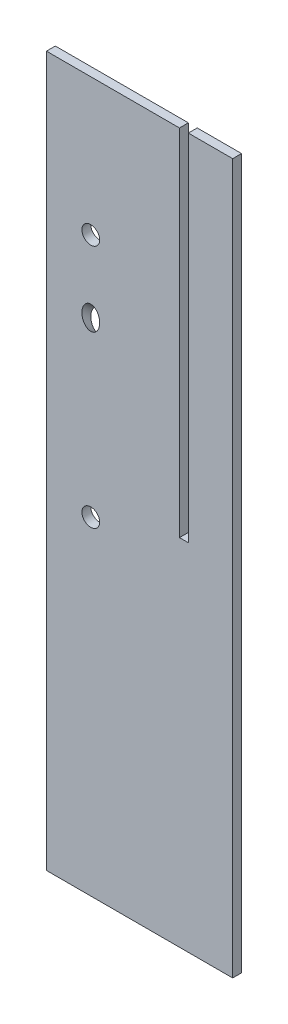
from build123d import *

# Parameters (mm, degrees)
SKETCH2_W               = 266.7
SKETCH2_H               = 1016
BOSS_EXTRUDE1_DEPTH     = 6.35
CAVITY1_START           = -6.35
CAVITY1_OUTLINE_R       = 12.7
CAVITY1_DEPTH           = 12.7
CAVITY1_START_2         = 449.025238005
CAVITY1_2_OUTLINE_R     = 12.7
CAVITY1_2_DEPTH         = 39.100356678
CUT_EXTRUDE3_DEPTH      = 1025.733401915
CUT_EXTRUDE3_DEPTH_BACK = 1025.733401915
SKETCH5_W               = 12.7
SKETCH5_H               = 508


# Read off the part's stored shape, not the designer's step: Cavity1
with BuildPart() as part:
    # Sketch2 → Boss-Extrude1 (new, symmetric)
    with BuildSketch(Plane.XY):
        with Locations((0, 508)):
            Rectangle(SKETCH2_W, SKETCH2_H)
    extrude(amount=BOSS_EXTRUDE1_DEPTH, both=True)

    # Cavity1 outline → Cavity1 (cut)
    with BuildSketch(Plane.XY.offset(CAVITY1_START)):
        with Locations((-69.85, 819.9)):
            Circle(CAVITY1_OUTLINE_R)
        with Locations((-69.85, 469.9)):
            Circle(CAVITY1_OUTLINE_R)
    extrude(amount=CAVITY1_DEPTH, mode=Mode.SUBTRACT)

    # Cavity1 2 outline → Cavity1 2 (cut)
    with BuildSketch(Plane(origin=(0, 0, 0), x_dir=(1, 0, 0), z_dir=(0, 0.658504607868519, 0.752576694706877)).offset(CAVITY1_START_2)):
        with Locations((-69.85, 535.514761536)):
            Circle(CAVITY1_2_OUTLINE_R)
    extrude(amount=CAVITY1_2_DEPTH, mode=Mode.SUBTRACT)

    # Sketch5 → Cut-Extrude3 (cut, two sides: drawn at the far end of the back side and taken through both)
    with BuildSketch(Plane.XY.offset(-CUT_EXTRUDE3_DEPTH_BACK)):
        with Locations((63.5, 762)):
            Rectangle(SKETCH5_W, SKETCH5_H)
    extrude(amount=CUT_EXTRUDE3_DEPTH + CUT_EXTRUDE3_DEPTH_BACK, mode=Mode.SUBTRACT)


solid = part.part
